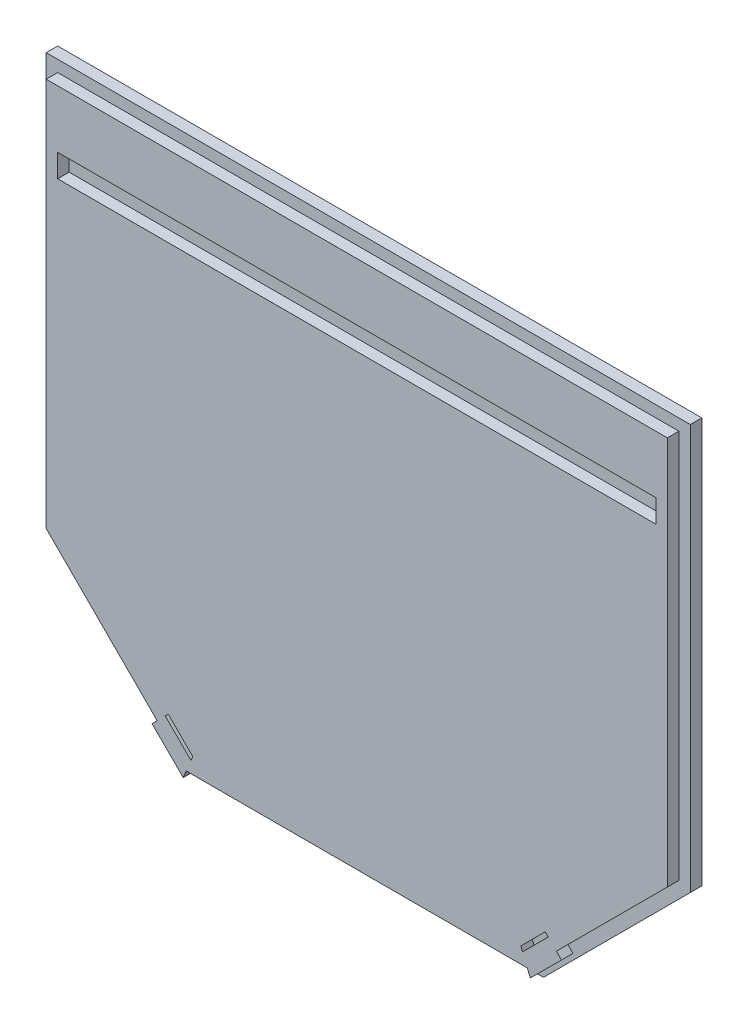
from build123d import *

# Parameters (mm, degrees)
BOSS_EXTRUDE1_DEPTH = 12.7
SKETCH2_W           = 330.2
SKETCH2_H           = 12.7
CUT_EXTRUDE1_DEPTH  = 6.35
CUT_EXTRUDE3_DEPTH  = 6.35


with BuildPart() as part:
    # Sketch1 → Boss-Extrude1 (new body)
    with BuildSketch(Plane.XY):
        Polygon((0, 0), (355.6, 0), (355.6, -223.774), (292.534512242, -286.839487758), (274.574, -304.8), (81.026, -304.8), (63.065487758, -286.839487758), (0, -223.774), align=None)
    extrude(amount=BOSS_EXTRUDE1_DEPTH)

    # Sketch2 → Cut-Extrude1 (cut)
    # profile 1 of 2: a face of its own
    with BuildSketch(Plane.XY.offset(12.7)):
        Polygon((355.6, 0), (0, 0), (0, -223.774), (81.026, -304.8), (274.574, -304.8), (355.6, -223.774), align=None)
        Polygon((67.607470696, -282.401214575), (6.35, -221.143743879), (6.35, -6.35), (349.25, -6.35), (349.25, -221.143743879), (287.992529304, -282.401214575), (290.812329726, -285.221014997), (273.595544723, -302.4378), (271.943743879, -298.45), (83.656256121, -298.45), (82.004455277, -302.4378), (64.787670274, -285.221014997), align=None, mode=Mode.SUBTRACT)
    # profile 2 of 2: a face of its own
    with BuildSketch(Plane.XY.offset(12.7)):
        with Locations((177.8, -44.45)):
            Rectangle(SKETCH2_W, SKETCH2_H)
    extrude(amount=-CUT_EXTRUDE1_DEPTH, mode=Mode.SUBTRACT)

    # Sketch3 → Cut-Extrude3 (cut)
    with BuildSketch(Plane.XY.offset(12.7)):
        Polygon((86.286512242, -292.1), (72.097707571, -277.911195329), (73.768035209, -276.24086769), (87.264967519, -289.7378), align=None)
        Polygon((283.502292429, -277.911195329), (281.831964791, -276.24086769), (268.335032481, -289.7378), (269.313487758, -292.1), align=None)
    extrude(amount=-CUT_EXTRUDE3_DEPTH, mode=Mode.SUBTRACT)


solid = part.part
